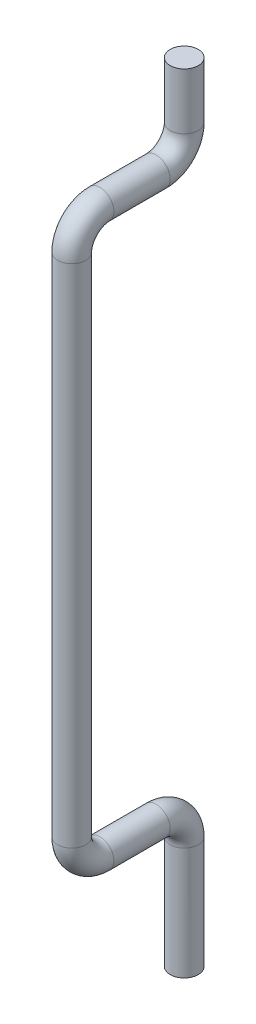
from build123d import *

# Parameters (mm, degrees)
SKETCH2_R = 0.5


with BuildPart() as part:
    # Sweep1: sweep along a path in Sketch1
    with BuildLine(Plane(origin=(0, 0, 0), x_dir=(0, 0, -1), z_dir=(1, 0, 0))) as sweep1_path:
        Line((13.22, -2), (13.22, 2))
        ThreePointArc((13.22, 2), (12.927106781, 2.707106781), (12.22, 3))
        Line((12.22, 3), (10.22, 3))
        ThreePointArc((10.22, 3), (9.512893219, 3.292893219), (9.22, 4))
        Line((9.22, 4), (9.22, 22))
        ThreePointArc((9.22, 22), (9.512893219, 22.707106781), (10.22, 23))
        Line((10.22, 23), (12.22, 23))
        ThreePointArc((12.22, 23), (12.927106781, 23.292893219), (13.22, 24))
        Line((13.22, 24), (13.22, 26))
    # Sketch2 → Sweep1 (sweep)
    with BuildSketch(Plane(origin=(0, -2, 0), x_dir=(1, 0, 0), z_dir=(0, 1, 0))):
        with Locations((0, 13.22)):
            Circle(SKETCH2_R)
    sweep(path=sweep1_path.line)


solid = part.part
